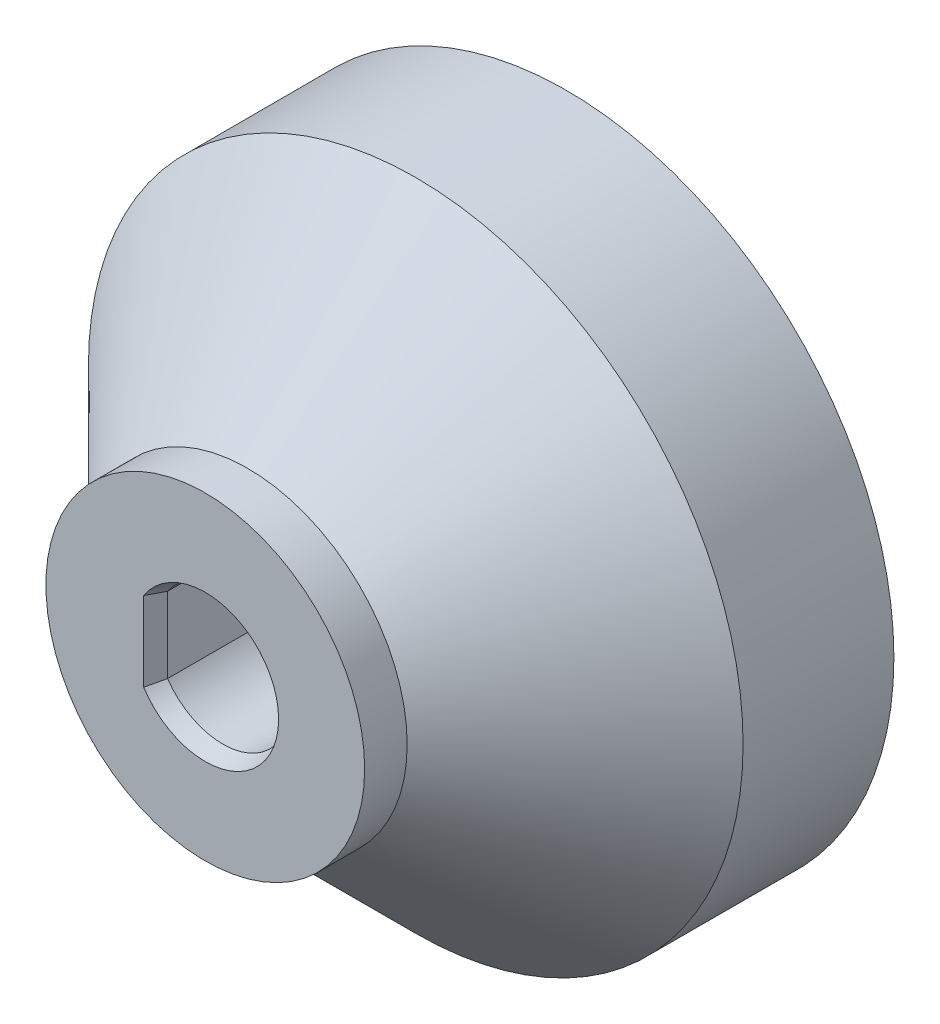
from build123d import *
from OCP.BRepFilletAPI import BRepFilletAPI_MakeChamfer

# Parameters (mm, degrees)
SKETCH1_R           = 7.5
BOSS_EXTRUDE1_DEPTH = 10
SKETCH2_R           = 15.403290795
BOSS_EXTRUDE2_DEPTH = 7
SKETCH4_R           = 6.56
CUT_EXTRUDE1_DEPTH  = 5
CHAMFER1_SIZE       = 8
CHAMFER2_SIZE       = 0.3
CHAMFER2_SIZE2      = 0.824243226


with BuildPart() as part:
    # Sketch1 → Boss-Extrude1 (new body)
    with BuildSketch(Plane.XY):
        Circle(SKETCH1_R)
        with BuildLine():
            Line((-2.6, -1.778341924), (-2.6, 1.778341924))
            ThreePointArc((-2.6, 1.778341924), (3.15, 0), (-2.6, -1.778341924))
        make_face(mode=Mode.SUBTRACT)
    extrude(amount=BOSS_EXTRUDE1_DEPTH)

    # Sketch2 → Boss-Extrude2 (add)
    with BuildSketch(Plane.XY):
        Circle(SKETCH2_R)
    extrude(amount=-BOSS_EXTRUDE2_DEPTH)

    # Sketch4 → Cut-Extrude1 (cut)
    with BuildSketch(Plane(origin=(0, 0, -7), x_dir=(-1, 0, 0), z_dir=(0, 0, -1))):
        with Locations((0, 5)):
            Circle(SKETCH4_R)
    extrude(amount=-CUT_EXTRUDE1_DEPTH, mode=Mode.SUBTRACT)

    # Chamfer1
    # the kernel refuses this chamfer: 8 mm, written as the material it adds along each edge
    with BuildSketch(Plane(origin=(0, 0, 0), x_dir=(1, 0, 0), z_dir=(0, -1, 0))) as chamfer1_piece_1_section:
        Polygon((7.5 + CHAMFER1_SIZE, 0), (7.5, CHAMFER1_SIZE), (7.5, 0), align=None)
    chamfer1_piece_1 = revolve(axis=Axis((0, 0, 0), (0, 0, 1)), mode=Mode.PRIVATE)
    chamfer1_piece_1 = chamfer1_piece_1 & Plane(origin=(0, 0, 4.06906202), x_dir=(1, 0, 0), z_dir=(0, 0, 1)) * Cylinder(15.403290795, 62, mode=Mode.PRIVATE)
    add(chamfer1_piece_1)

    # Chamfer2: one chamfer whose edges measure the first distance from different faces: ONE call of the kernel's chamfer builder (chamfer() names one face for all edges)
    chamfer2_edges_1 = [part.edges().sort_by_distance(p)[0] for p in [
        (6.56, 5, -7),
    ]]
    chamfer2_side_1 = [part.faces().sort_by_distance(p)[0] for p in [
        (-14.96761994, 0, -7),
    ]]
    chamfer2_edges_2 = [part.edges().sort_by_distance(p)[0] for p in [
        (3.15, 0, 10),
        (-2.6, 0, 10),
    ]]
    chamfer2_side_2 = [part.faces().sort_by_distance(p)[0] for p in [
        (-7.287867966, 0, 10),
    ]]
    chamfer2 = BRepFilletAPI_MakeChamfer(part.part.solid().wrapped)
    for e in chamfer2_edges_1:
        chamfer2.Add(CHAMFER2_SIZE, CHAMFER2_SIZE2, e.wrapped, chamfer2_side_1[0].wrapped)  # the first distance lies on this face
    for e in chamfer2_edges_2:
        chamfer2.Add(CHAMFER2_SIZE, CHAMFER2_SIZE2, e.wrapped, chamfer2_side_2[0].wrapped)  # the first distance lies on this face
    add(Compound.cast(chamfer2.Shape()), mode=Mode.REPLACE)


solid = part.part
